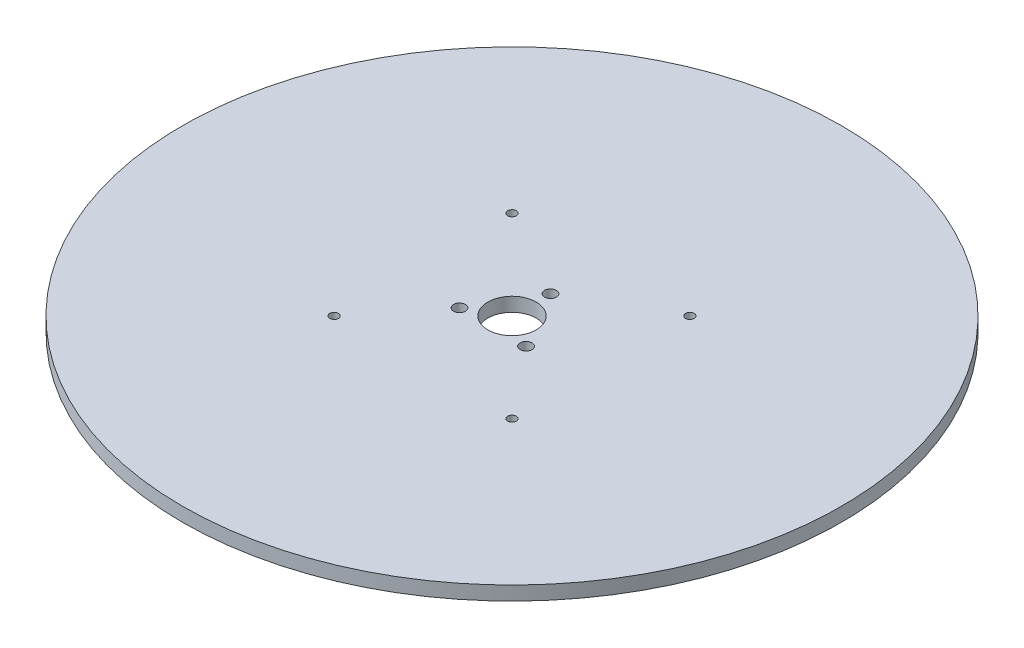
from build123d import *

# Parameters (mm, degrees)
SKETCH1_R           = 150
BOSS_EXTRUDE1_DEPTH = 6.35
SKETCH2_R           = 11
SKETCH2_R_2         = 1.984375
SKETCH2_R_3         = 2.7
CUT_EXTRUDE1_DEPTH  = 213.227054119


with BuildPart() as part:
    # Sketch1 → Boss-Extrude1 (new body)
    with BuildSketch(Plane(origin=(0, 0, 0), x_dir=(1, 0, 0), z_dir=(0, 1, 0))):
        Circle(SKETCH1_R)
    extrude(amount=BOSS_EXTRUDE1_DEPTH)

    # Sketch2 → Cut-Extrude1 (cut, through all)
    with BuildSketch(Plane(origin=(0, 6.35, 0), x_dir=(1, 0, 0), z_dir=(0, 1, 0))):
        Circle(SKETCH2_R)
        with Locations((-40.4876, 40.4876)):
            Circle(SKETCH2_R_2)
        with Locations((-40.4876, -40.4876)):
            Circle(SKETCH2_R_2)
        with Locations((40.4876, -40.4876)):
            Circle(SKETCH2_R_2)
        with Locations((40.4876, 40.4876)):
            Circle(SKETCH2_R_2)
        with Locations((0, 17.5)):
            Circle(SKETCH2_R_3)
        with Locations((-15.155444566, -8.75)):
            Circle(SKETCH2_R_3)
        with Locations((15.155444566, -8.75)):
            Circle(SKETCH2_R_3)
    extrude(amount=-CUT_EXTRUDE1_DEPTH, mode=Mode.SUBTRACT)


solid = part.part
